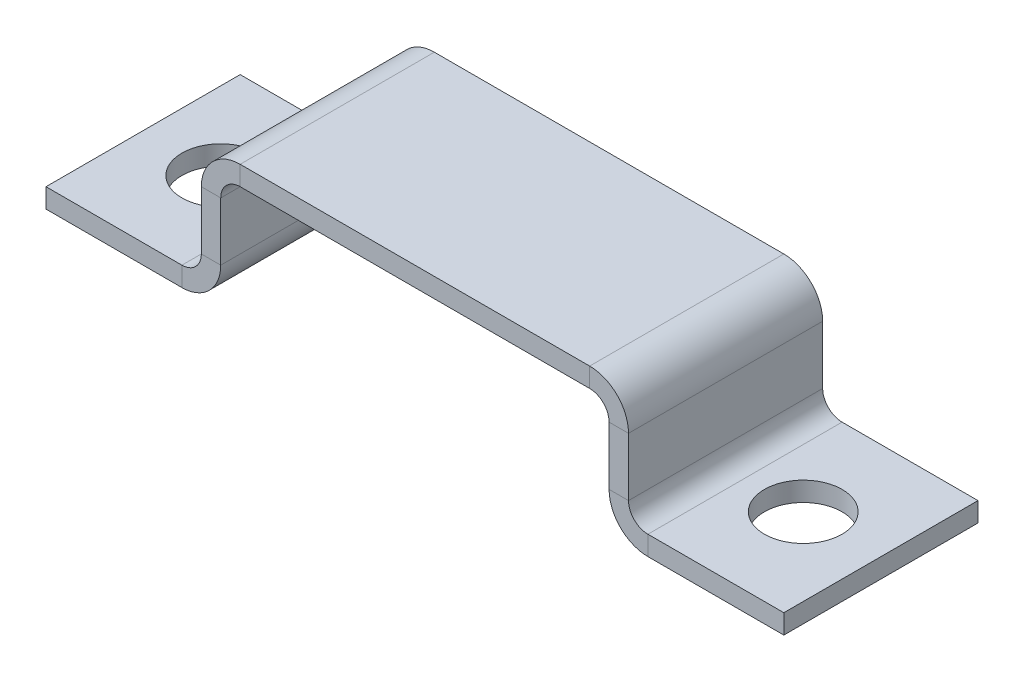
from build123d import *

# Parameters (mm, degrees)
BASE_FLANGE1_DEPTH = 5
SKETCH7_R          = 1
CUT_EXTRUDE1_DEPTH = 10


# Sheet-metal steps are written as plain solids
with BuildPart() as part:
    # Sketch2 → Base-Flange1 (new body)
    with BuildSketch(Plane.XY):
        with BuildLine():
            Line((-9.5, 0), (-6, 0))
            ThreePointArc((-6, 0), (-5.292893219, 0.292893219), (-5, 1))
            Line((-5, 1), (-5, 2.5))
            ThreePointArc((-5, 2.5), (-4.853553391, 2.853553391), (-4.5, 3))
            Line((-4.5, 3), (4.5, 3))
            ThreePointArc((4.5, 3), (4.853553391, 2.853553391), (5, 2.5))
            Line((5, 2.5), (5, 1))
            ThreePointArc((5, 1), (5.292893219, 0.292893219), (6, 0))
            Line((6, 0), (9.5, 0))
            Line((9.5, 0), (9.5, 0.5))
            Line((9.5, 0.5), (6, 0.5))
            ThreePointArc((6, 0.5), (5.646446609, 0.646446609), (5.5, 1))
            Line((5.5, 1), (5.5, 2.5))
            ThreePointArc((5.5, 2.5), (5.207106781, 3.207106781), (4.5, 3.5))
            Line((4.5, 3.5), (-4.5, 3.5))
            ThreePointArc((-4.5, 3.5), (-5.207106781, 3.207106781), (-5.5, 2.5))
            Line((-5.5, 2.5), (-5.5, 1))
            ThreePointArc((-5.5, 1), (-5.646446609, 0.646446609), (-6, 0.5))
            Line((-6, 0.5), (-9.5, 0.5))
            Line((-9.5, 0.5), (-9.5, 0))
        make_face()
    extrude(amount=BASE_FLANGE1_DEPTH)

    # Sketch7 → Cut-Extrude1 (cut)
    with BuildSketch(Plane(origin=(0, 0.5, 0), x_dir=(1, 0, 0), z_dir=(0, 1, 0))):
        with Locations(Location((-7.5, -2.5, 0), (0, 0, 180))):
            Circle(SKETCH7_R)
        with Locations((7.5, -2.5)):
            Circle(SKETCH7_R)
    extrude(amount=-CUT_EXTRUDE1_DEPTH, mode=Mode.SUBTRACT)


solid = part.part
